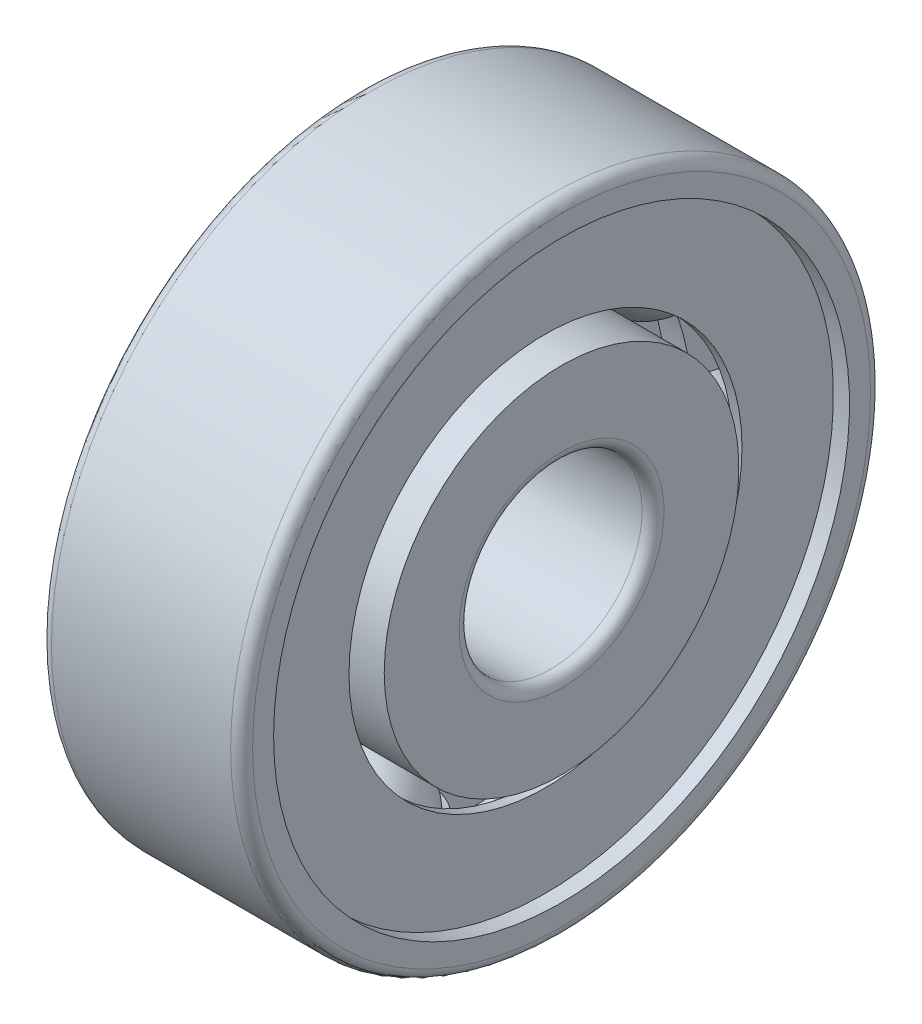
from build123d import *

# Parameters (mm, degrees)
PATTERN_CIRCULAR_1_COUNT = 7
SKETCH_5_W               = 6.984999999999999
SKETCH_5_H               = 3.4924999999999997
PATTERN_CIRCULAR_2_COUNT = 7
SKETCH_11_R              = 17.500000000000004
CUT_EXTRUDE_1_DEPTH      = 10


with BuildPart() as part:
    # 草图2 → Revolve 281 (revolve)
    with BuildSketch(Plane.XY):
        Polygon((-0.6985000000000005, 13.598125000000001), (0.6984999999999996, 13.598125000000001), (0.6984999999999999, 11.851875000000001), (-0.6985000000000002, 11.851875000000001), align=None)
    revolve(axis=Axis((-12.420610377460992, 0, 0), (1, 0, 0)))

    # 草图3 → 凸台-旋转1 (revolve)
    with BuildSketch(Plane.XY):
        with BuildLine():
            Line((-3.4924999999999997, 12.725), (3.492499999999999, 12.725000000000001))
            ThreePointArc((3.492499999999999, 12.725000000000001), (-1.08e-15, 9.2325), (-3.4924999999999997, 12.725))
        make_face()
    revolve_1 = revolve(axis=Axis((-5.568093778513548, 12.725, 0), (1, 0, 0)))

    # 阵列(圆周)1: 凸台-旋转1 ×7 about axis
    pattern_circular_1_axis = Axis((-12.420610377460992, 0, 0), (1, 0, 0))
    for i in range(1, PATTERN_CIRCULAR_1_COUNT):
        add(revolve_1.rotate(pattern_circular_1_axis, i * 360 / PATTERN_CIRCULAR_1_COUNT))

    # 草图4 → 切除-旋转1 (revolve, cut)
    with BuildSketch(Plane.XY):
        Polygon((-3.4925000000000015, 17.090625000000003), (3.4924999999999975, 17.090625000000003), (3.492499999999998, 13.598125000000001), (-3.4925000000000006, 13.598125000000001), align=None)
    revolve(axis=Axis((0, 0, 0), (1, 0, 0)), mode=Mode.SUBTRACT)

    # 草图5 → 切除-旋转2 (revolve, cut)
    with BuildSketch(Plane.XY):
        with Locations((-1.33e-15, 10.105625000000002)):
            Rectangle(SKETCH_5_W, SKETCH_5_H)
    revolve(axis=Axis((0, 0, 0), (1, 0, 0)), mode=Mode.SUBTRACT)

    # 草图6 → 凸台-旋转2 (revolve)
    with BuildSketch(Plane.XY):
        with BuildLine():
            Line((-3.175, 12.725), (3.175, 12.725))
            ThreePointArc((3.175, 12.725), (-5.8e-16, 9.55), (-3.175, 12.725))
        make_face()
    revolve_2 = revolve(axis=Axis((-5.568093778513548, 12.725, 0), (1, 0, 0)))

    # 阵列(圆周)2: 凸台-旋转2 ×7 about axis
    pattern_circular_2_axis = Axis((-12.420610377460992, 0, 0), (1, 0, 0))
    for i in range(1, PATTERN_CIRCULAR_2_COUNT):
        add(revolve_2.rotate(pattern_circular_2_axis, i * 360 / PATTERN_CIRCULAR_2_COUNT))

    # 草图7 → 凸台-旋转3 (revolve)
    with BuildSketch(Plane.XY):
        with BuildLine():
            Line((-4.900000000000001, 17.5), (4.8999999999999995, 17.5))
            ThreePointArc((4.8999999999999995, 17.5), (5.324264068711926, 17.32426406871193), (5.5, 16.900000000000002))
            Line((5.5, 16.900000000000002), (5.5, 15.75))
            Line((5.5, 15.75), (4.619999999999999, 15.75))
            Line((4.619999999999999, 15.75), (4.619999999999999, 14.75))
            Line((4.619999999999999, 14.75), (4.0847976112309805, 14.75))
            Line((4.0847976112309805, 14.75), (4.0847976112309805, 15.75))
            Line((4.0847976112309805, 15.75), (0.930913529818962, 15.75))
            ThreePointArc((0.930913529818962, 15.75), (1.9e-16, 15.89), (-0.930913529818962, 15.75))
            Line((-0.930913529818962, 15.75), (-5.500000000000001, 15.75))
            Line((-5.500000000000001, 15.75), (-5.500000000000002, 16.9))
            ThreePointArc((-5.500000000000002, 16.9), (-5.32426406871193, 17.324264068711926), (-4.900000000000001, 17.5))
        make_face()
    revolve(axis=Axis((0, 0, 0), (1, 0, 0)))

    # 草图8 → 凸台-旋转4 (revolve)
    with BuildSketch(Plane.XY):
        with BuildLine():
            Line((-5.5, 9.700000000000001), (-0.930913529818962, 9.700000000000001))
            ThreePointArc((-0.930913529818962, 9.700000000000001), (1.9e-16, 9.56), (0.930913529818962, 9.700000000000001))
            Line((0.930913529818962, 9.700000000000001), (5.500000000000002, 9.7))
            Line((5.500000000000002, 9.7), (5.500000000000002, 5.6000000000000005))
            ThreePointArc((5.500000000000002, 5.6000000000000005), (5.32426406871193, 5.175735931288072), (4.900000000000001, 5))
            Line((4.900000000000001, 5), (-4.9, 5))
            ThreePointArc((-4.9, 5), (-5.324264068711929, 5.175735931288072), (-5.5, 5.6000000000000005))
            Line((-5.5, 5.6000000000000005), (-5.5, 9.700000000000001))
        make_face()
    revolve(axis=Axis((-12.420610377460992, 0, 0), (1, 0, 0)))

    # 草图10 → 凸台-旋转5 (revolve)
    with BuildSketch(Plane.XY):
        Polygon((4.619999999999999, 14.75), (4.084797611230977, 14.75), (4.0847976112309805, 10.74775), (4.619999999999999, 10.74775), align=None)
    revolve(axis=Axis((0, 0, 0), (-1, 0, 0)))

    # 草图11 → 切除-拉伸1 (cut)
    with BuildSketch(Plane(origin=(0, 0, 0), x_dir=(0, 0, -1), z_dir=(1, 0, 0))):
        Circle(SKETCH_11_R)
    extrude(amount=-CUT_EXTRUDE_1_DEPTH, mode=Mode.SUBTRACT)

    # 镜向所有1: part across plane


with BuildPart() as part_1:
    add(part.part)
    add(part.part.mirror(Plane(origin=(0, 0, 0), x_dir=(0, 0, 1), z_dir=(1, 0, 0))))


solid = part_1.part
